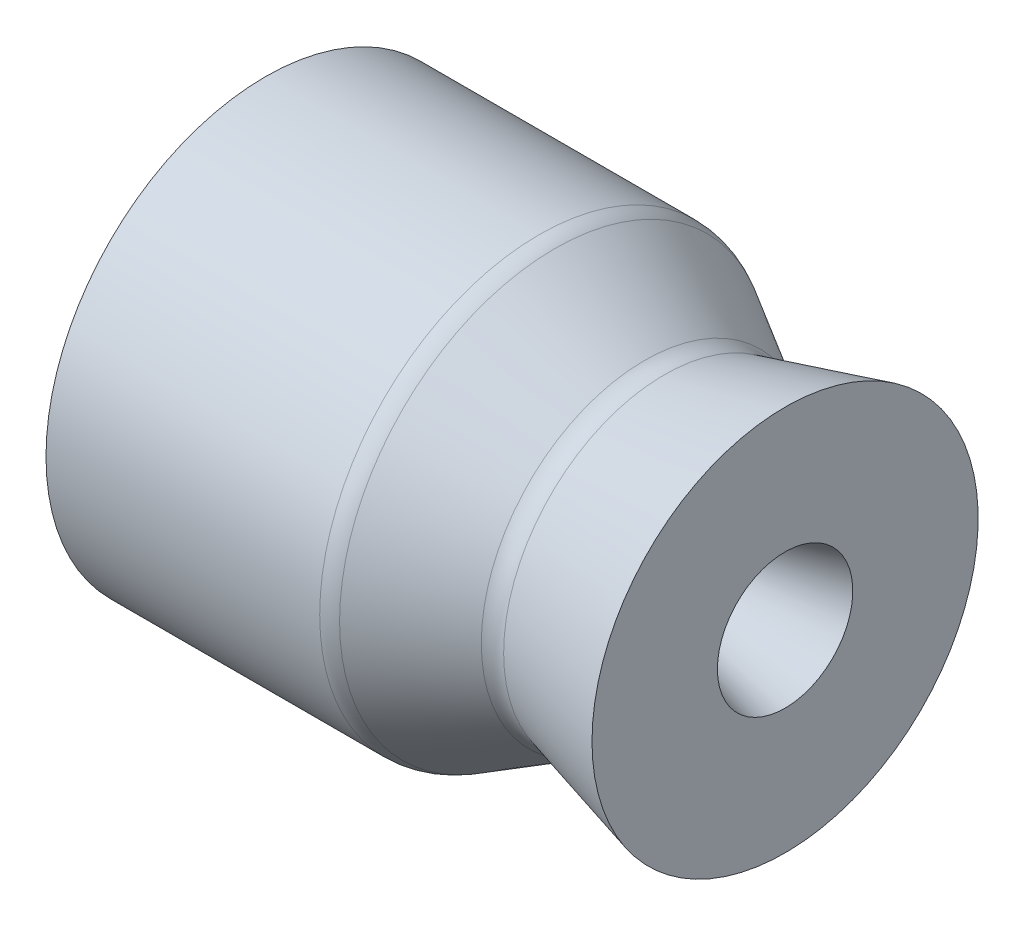
from build123d import *

# Parameters (mm, degrees)
CIRPATTERN1_COUNT = 5


with BuildPart() as part:
    # chamberNozzle → Revolve1 (revolve)
    with BuildSketch(Plane.XY):
        with BuildLine():
            Line((0, 38.1), (110.897045256, 38.1))
            ThreePointArc((110.897045256, 38.1), (114.184047129, 37.667257994), (117.247045256, 36.398522628))
            Line((117.247045256, 36.398522628), (153.648338424, 15.382226219))
            ThreePointArc((153.648338424, 15.382226219), (157.542961832, 14.060179716), (161.647049978, 14.329175865))
            Line((161.647049978, 14.329175865), (210.545228126, 27.431403211))
            Line((210.545228126, 27.431403211), (210.545228126, 78.231403211))
            Line((210.545228126, 78.231403211), (161.647049978, 65.129175865))
            ThreePointArc((161.647049978, 65.129175865), (157.542961832, 64.860179716), (153.648338424, 66.182226219))
            Line((153.648338424, 66.182226219), (117.247045256, 87.198522628))
            ThreePointArc((117.247045256, 87.198522628), (114.184047129, 88.467257994), (110.897045256, 88.9))
            Line((110.897045256, 88.9), (0, 88.9))
            Line((0, 88.9), (0, 55.88))
            Line((0, 55.88), (5.08, 55.88))
            Line((5.08, 55.88), (5.08, 45.72))
            Line((5.08, 45.72), (0, 45.72))
            Line((0, 45.72), (0, 38.1))
        make_face()
    revolve(axis=Axis((0, 0, 0), (1, 0, 0)))

    # Sketch3 → 1/2 (0.5) Diameter Hole1 (revolve, cut)
    with BuildSketch(Plane(origin=(0, 0, -72.39), x_dir=(0, 0, 1), z_dir=(0, 1, 0))):
        Polygon((0, 0), (0, 16.515464931), (6.35, 12.7), (6.35, 0.635), (6.985, 0), align=None)
    f_1_2_0_5_diameter_hole1 = revolve(axis=Axis((-6.35, 0, -72.39), (1, 0, 0)), mode=Mode.SUBTRACT)

    # CirPattern1: 1/2 (0.5) Diameter Hole1 ×5 about axis
    cirpattern1_axis = Axis((0, 0, 0), (-1, 0, 0))
    for i in range(1, CIRPATTERN1_COUNT):
        add(f_1_2_0_5_diameter_hole1.rotate(cirpattern1_axis, i * 360 / CIRPATTERN1_COUNT), mode=Mode.SUBTRACT)


solid = part.part
